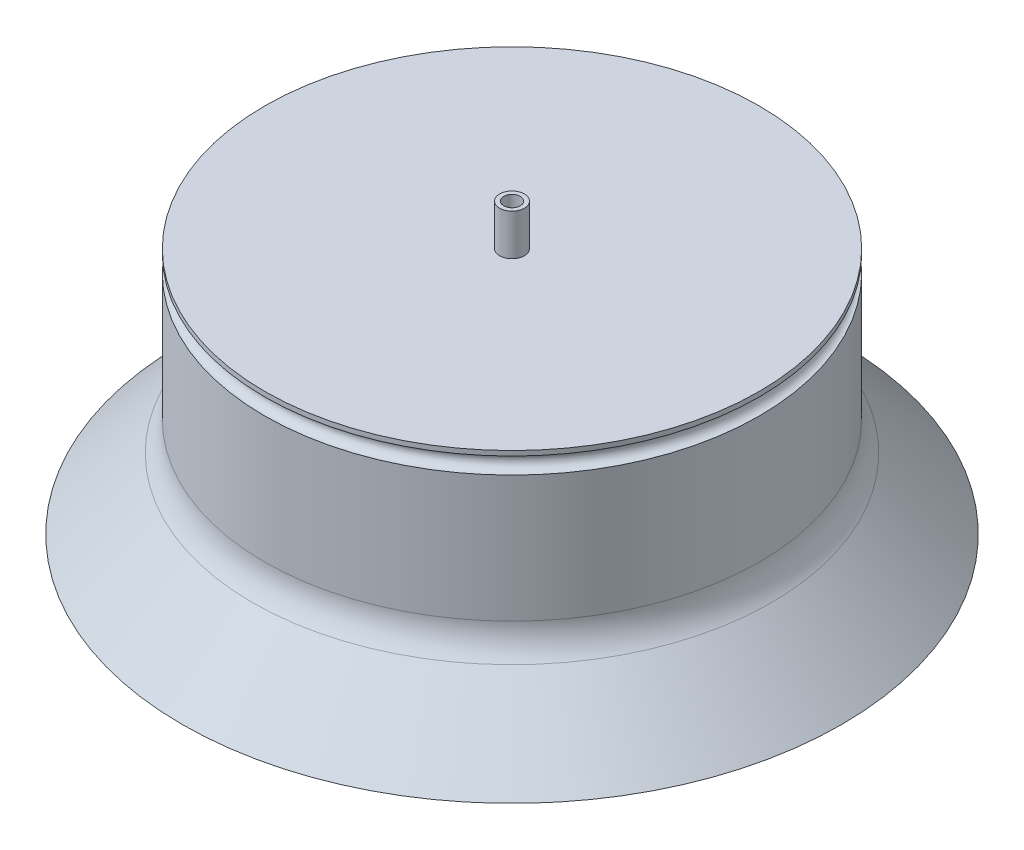
from build123d import *

# Parameters (mm, degrees)
BOSS_EXTRUDE1_DEPTH      = 20
BOSS_EXTRUDE1_DEPTH_BACK = 0.0001
SKETCH1_R                = 80
SKETCH2_R                = 60
BOSS_EXTRUDE2_DEPTH      = 40
SKETCH3_R                = 3
BOSS_EXTRUDE3_DEPTH      = 10
SKETCH4_R                = 2
CUT_EXTRUDE1_DEPTH       = 20
CHAMFER1_SIZE            = 20
SKETCH5_R                = 2


with BuildPart() as part:
    # Sketch1 → Boss-Extrude1 (new, two sides: drawn at the far end of the back side and taken through both)
    with BuildSketch(Plane(origin=(0, 0, 0), x_dir=(1, 0, 0), z_dir=(0, 1, 0)).offset(-BOSS_EXTRUDE1_DEPTH_BACK)):
        with Locations(Location((0, 0, 0), (0, 0, 270))):
            Circle(SKETCH1_R)
    extrude(amount=BOSS_EXTRUDE1_DEPTH + BOSS_EXTRUDE1_DEPTH_BACK)

    # Sketch2 → Boss-Extrude2 (add)
    with BuildSketch(Plane(origin=(0, 20, 0), x_dir=(1, 0, 0), z_dir=(0, 1, 0))):
        with Locations(Location((0, 0, 0), (0, 0, 270))):
            Circle(SKETCH2_R)
    extrude(amount=BOSS_EXTRUDE2_DEPTH)

    # Sketch3 → Boss-Extrude3 (add)
    with BuildSketch(Plane(origin=(0, 60, 0), x_dir=(1, 0, 0), z_dir=(0, 1, 0))):
        with Locations(Location((0, 0, 0), (0, 0, 270))):
            Circle(SKETCH3_R)
    extrude(amount=BOSS_EXTRUDE3_DEPTH)

    # Sketch4 → Cut-Extrude1 (cut)
    with BuildSketch(Plane(origin=(0, 70, 0), x_dir=(1, 0, 0), z_dir=(0, 1, 0))):
        with Locations(Location((0, 0, 0), (0, 0, 270))):
            Circle(SKETCH4_R)
    extrude(amount=-CUT_EXTRUDE1_DEPTH, mode=Mode.SUBTRACT)

    # Chamfer1
    chamfer1_edges = [part.edges().sort_by_distance(p)[0] for p in [
        (0, 20, -80),
    ]]
    chamfer(chamfer1_edges, length=CHAMFER1_SIZE - 0.0001)  # a hair under: the kernel refuses the full size

    # Sketch5 → Cut-Revolve1 (revolve, cut)
    with BuildSketch(Plane(origin=(0, 0, 0), x_dir=(0, 0, -1), z_dir=(1, 0, 0))):
        with Locations((-60, 56.839030786)):
            Circle(SKETCH5_R)
    revolve(axis=Axis((0, 60, 0), (0, -1, 0)), mode=Mode.SUBTRACT)

    # Fillet1: read off the stored shape, not the designer's step
    # Fillet1 outline → Fillet1 (revolve)
    with BuildSketch(Plane.XY):
        with BuildLine():
            ThreePointArc((62.928932188, 17.071067812), (60.761204675, 20.3153013), (60, 24.142135624))
            Line((60, 24.142135624), (60, 17.071067812))
            Line((60, 17.071067812), (62.928932188, 17.071067812))
        make_face()
    revolve(axis=Axis((0, 0, 0), (0, 1, 0)))


solid = part.part
